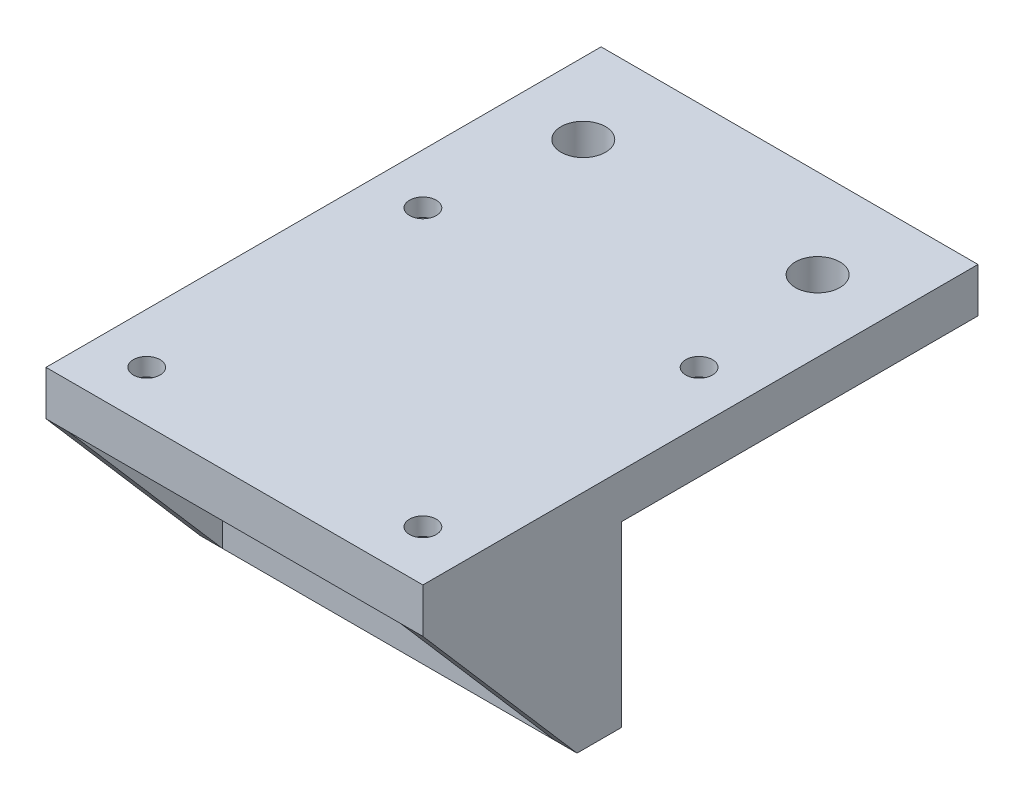
from build123d import *

# Parameters (mm, degrees)
SKETCH1_R           = 1.5
BOSS_EXTRUDE1_DEPTH = 5
SKETCH2_R           = 2.75
CUT_EXTRUDE1_DEPTH  = 3
SKETCH3_W           = 42.3
SKETCH3_H           = 5
BOSS_EXTRUDE2_DEPTH = 20
SKETCH7_R           = 2.5
CUT_EXTRUDE4_DEPTH  = 55.03373946
SKETCH8_R           = 2.5
CUT_EXTRUDE5_DEPTH  = 53.589400073
RIB1_REACH          = 64.311
SKETCH9_WALL_W      = 153.06531809
SKETCH9_WALL_H      = 2.5


with BuildPart() as part:
    # Sketch1 → Boss-Extrude1 (new body)
    with BuildSketch(Plane(origin=(0, 0, 0), x_dir=(1, 0, 0), z_dir=(0, 1, 0))):
        Polygon((-21.15, -21.15), (21.15, -21.15), (21.15, 21.15), (21.15, 41.15), (-21.15, 41.15), (-21.15, 21.15), align=None)
        with Locations((-15.5, 15.5)):
            Circle(SKETCH1_R, mode=Mode.SUBTRACT)
        with Locations((15.5, 15.5)):
            Circle(SKETCH1_R, mode=Mode.SUBTRACT)
        with Locations((-15.5, -15.5)):
            Circle(SKETCH1_R, mode=Mode.SUBTRACT)
        with Locations((15.5, -15.5)):
            Circle(SKETCH1_R, mode=Mode.SUBTRACT)
    extrude(amount=BOSS_EXTRUDE1_DEPTH)

    # Sketch2 → Cut-Extrude1 (cut)
    with BuildSketch(Plane.XZ):
        with Locations((-15.5, 15.5)):
            Circle(SKETCH2_R)
        with Locations((-15.5, -15.5)):
            Circle(SKETCH2_R)
        with Locations((15.5, 15.5)):
            Circle(SKETCH2_R)
        with Locations((15.5, -15.5)):
            Circle(SKETCH2_R)
    extrude(amount=-CUT_EXTRUDE1_DEPTH, mode=Mode.SUBTRACT)

    # Sketch3 → Boss-Extrude2 (add)
    with BuildSketch(Plane.XZ):
        with Locations((0, 1.35)):
            Rectangle(SKETCH3_W, SKETCH3_H)
    extrude(amount=BOSS_EXTRUDE2_DEPTH)

    # Sketch7 → Cut-Extrude4 (cut, through all)
    with BuildSketch(Plane(origin=(0, 1.15, 3.85), x_dir=(1, 0, 0), z_dir=(0, 0, -1))):
        with Locations((-13.15, 11.15)):
            Circle(SKETCH7_R)
        with Locations((13.15, 11.15)):
            Circle(SKETCH7_R)
    extrude(amount=CUT_EXTRUDE4_DEPTH, mode=Mode.SUBTRACT)

    # Sketch8 → Cut-Extrude5 (cut, through all)
    with BuildSketch(Plane(origin=(0, 5, 0), x_dir=(1, 0, 0), z_dir=(0, 1, 0))):
        with Locations((-13.15, 31.15)):
            Circle(SKETCH8_R)
        with Locations((13.15, 31.15)):
            Circle(SKETCH8_R)
    extrude(amount=-CUT_EXTRUDE5_DEPTH, mode=Mode.SUBTRACT)

    # Sketch9 wall → Rib1 (add, up to next)
    with BuildSketch(Plane(origin=(-21.15, -10, 12.5), x_dir=(0, 0.756312601861, 0.65421040061), z_dir=(0, 0.65421040061, -0.756312601861)), mode=Mode.PRIVATE) as rib1_sk1:
        with Locations((0, 1.25)):
            Rectangle(SKETCH9_WALL_W, SKETCH9_WALL_H)
    rib1_tool1 = extrude(rib1_sk1.sketch, amount=RIB1_REACH, mode=Mode.PRIVATE) - part.part
    rib1 = rib1_tool1.solids().sort_by_distance((-21.15, -10, 12.5))[0]
    add(rib1)

    # Mirror1: Rib1 across plane
    add(rib1.mirror(Plane.ZY))


solid = part.part
